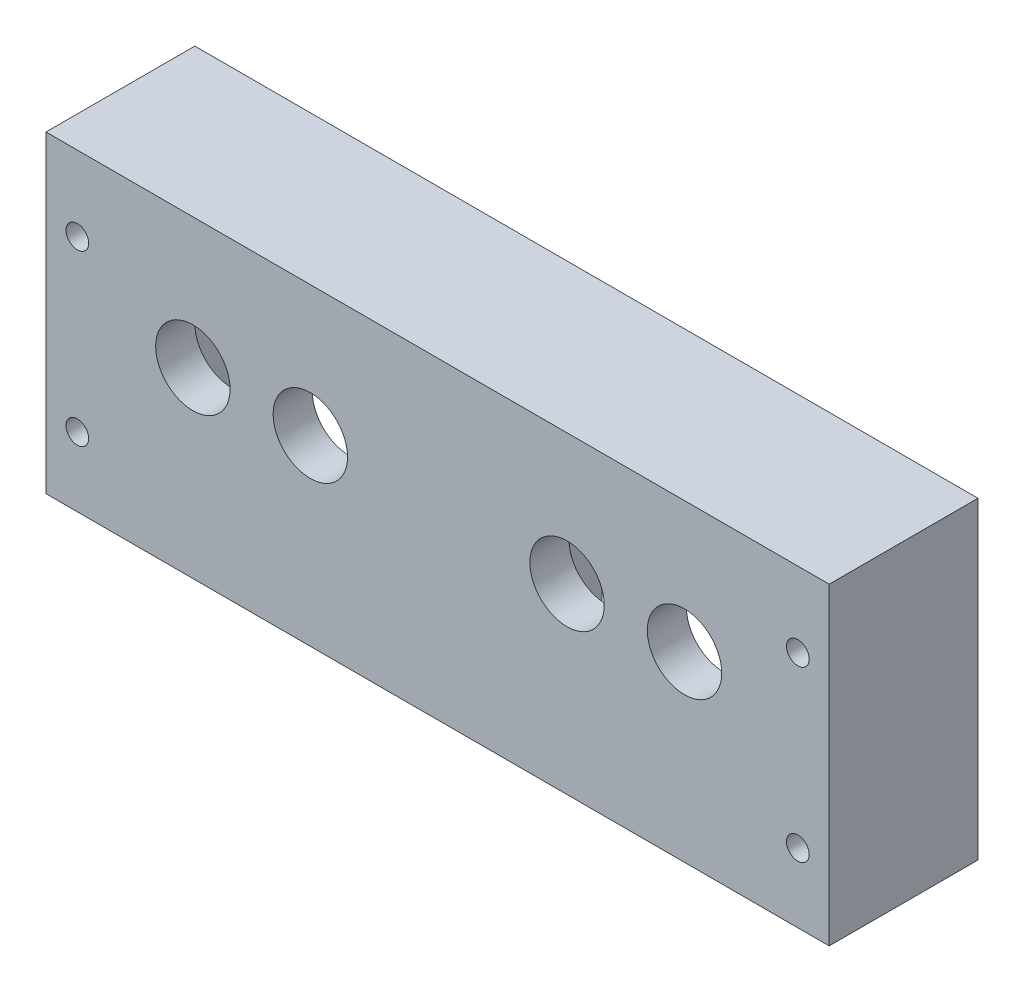
from build123d import *

# Parameters (mm, degrees)
SKETCH1_W           = 100
SKETCH1_H           = 40
BOSS_EXTRUDE1_DEPTH = 38
CUT_EXTRUDE2_START  = -12
SKETCH2_W           = 39.5
SKETCH2_H           = 34
CUT_EXTRUDE2_DEPTH  = 21
CUT_EXTRUDE3_DEPTH  = 9
CUT_EXTRUDE4_REACH  = 81.36
SKETCH4_R           = 1.45
SKETCH5_W           = 100
SKETCH5_H           = 19
CUT_EXTRUDE5_DEPTH  = 87.215210375
FILLET1_R           = 0.5
CUT_EXTRUDE9_START  = 13.5
CUT_EXTRUDE9_DEPTH  = 0.5
CUT_EXTRUDE9_TAPER  = 2
CUT_EXTRUDE10_START = 13.5
CUT_EXTRUDE10_DEPTH = 0.5
CUT_EXTRUDE10_TAPER = 2
CUT_EXTRUDE11_REACH = 73.063
SKETCH10_R          = 4.75


with BuildPart() as part:
    # Sketch1 → Boss-Extrude1 (new body)
    with BuildSketch(Plane.XY):
        with Locations((16.25, 1.5625)):
            Rectangle(SKETCH1_W, SKETCH1_H)
    extrude(amount=BOSS_EXTRUDE1_DEPTH)

    # Sketch2 → Cut-Extrude2 (cut)
    with BuildSketch(Plane(origin=(0, 0, 0), x_dir=(-1, 0, 0), z_dir=(0, 0, -1)).offset(CUT_EXTRUDE2_START)):
        with Locations((-38.5, 1.5625)):
            Rectangle(SKETCH2_W, SKETCH2_H)
        with Locations((6, 1.5625)):
            Rectangle(SKETCH2_W, SKETCH2_H)
    extrude(amount=-CUT_EXTRUDE2_DEPTH, mode=Mode.SUBTRACT)

    # Sketch3 → Cut-Extrude3 (cut)
    with BuildSketch(Plane(origin=(-3.362318072, 0, 0), x_dir=(-1, 0, 0), z_dir=(0, 0, -1))):
        with BuildLine():
            ThreePointArc((-61.593370612, 1.614325749), (-20.676836723, -17.421621422), (21.715969185, -1.949710178))
            ThreePointArc((21.715969185, -1.949710178), (22.204299442, 9.465009595), (10.78957967, 9.953339852))
            ThreePointArc((10.78957967, 9.953339852), (-19.986233449, -1.278769909), (-49.690320582, 12.540715264))
            ThreePointArc((-49.690320582, 12.540715264), (-61.105040355, 13.029045522), (-61.593370612, 1.614325749))
        make_face()
    extrude(amount=-CUT_EXTRUDE3_DEPTH, mode=Mode.SUBTRACT)

    # Sketch4 → Cut-Extrude4 (cut, up to next)
    with BuildSketch(Plane(origin=(0, 0, 0), x_dir=(-1, 0, 0), z_dir=(0, 0, -1)), mode=Mode.PRIVATE) as cut_extrude4_sk1:
        with Locations((-62.25, 11.98479819)):
            Circle(SKETCH4_R)
    cut_extrude4_tool1 = extrude(cut_extrude4_sk1.sketch, amount=-CUT_EXTRUDE4_REACH, mode=Mode.PRIVATE) & part.part
    # Sketch4 → Cut-Extrude4 (cut, up to next)
    with BuildSketch(Plane(origin=(0, 0, 0), x_dir=(-1, 0, 0), z_dir=(0, 0, -1)), mode=Mode.PRIVATE) as cut_extrude4_sk2:
        with Locations((-62.25, -9.616561755)):
            Circle(SKETCH4_R)
    cut_extrude4_tool2 = extrude(cut_extrude4_sk2.sketch, amount=-CUT_EXTRUDE4_REACH, mode=Mode.PRIVATE) & part.part
    # Sketch4 → Cut-Extrude4 (cut, up to next)
    with BuildSketch(Plane(origin=(0, 0, 0), x_dir=(-1, 0, 0), z_dir=(0, 0, -1)), mode=Mode.PRIVATE) as cut_extrude4_sk3:
        with Locations((29.75, 11.98479819)):
            Circle(SKETCH4_R)
    cut_extrude4_tool3 = extrude(cut_extrude4_sk3.sketch, amount=-CUT_EXTRUDE4_REACH, mode=Mode.PRIVATE) & part.part
    # Sketch4 → Cut-Extrude4 (cut, up to next)
    with BuildSketch(Plane(origin=(0, 0, 0), x_dir=(-1, 0, 0), z_dir=(0, 0, -1)), mode=Mode.PRIVATE) as cut_extrude4_sk4:
        with Locations((29.75, -9.616561755)):
            Circle(SKETCH4_R)
    cut_extrude4_tool4 = extrude(cut_extrude4_sk4.sketch, amount=-CUT_EXTRUDE4_REACH, mode=Mode.PRIVATE) & part.part
    add(cut_extrude4_tool1.solids().sort_by_distance((62.25, 11.984798, 0))[0], mode=Mode.SUBTRACT)
    add(cut_extrude4_tool2.solids().sort_by_distance((62.25, -9.616562, 0))[0], mode=Mode.SUBTRACT)
    add(cut_extrude4_tool3.solids().sort_by_distance((-29.75, 11.984798, 0))[0], mode=Mode.SUBTRACT)
    add(cut_extrude4_tool4.solids().sort_by_distance((-29.75, -9.616562, 0))[0], mode=Mode.SUBTRACT)

    # Sketch5 → Cut-Extrude5 (cut, through all)
    with BuildSketch(Plane(origin=(0, 21.5625, 0), x_dir=(1, 0, 0), z_dir=(0, 1, 0))):
        with Locations((16.25, -9.5)):
            Rectangle(SKETCH5_W, SKETCH5_H)
    extrude(amount=-CUT_EXTRUDE5_DEPTH, mode=Mode.SUBTRACT)

    # Fillet1
    fillet1_edges = [part.edges().sort_by_distance(p)[0] for p in [
        (18.75, 18.5625, 26),
        (58.25, 18.5625, 26),
        (58.25, -15.4375, 26),
        (18.75, -15.4375, 26),
        (13.75, -15.4375, 26),
        (13.75, 18.5625, 26),
        (-25.75, 18.5625, 26),
        (-25.75, -15.4375, 26),
    ]]
    fillet(fillet1_edges, radius=FILLET1_R)

    # Sketch8 → Cut-Extrude9 (cut)
    with BuildSketch(Plane(origin=(0, 0, 33), x_dir=(-1, 0, 0), z_dir=(0, 0, -1)).offset(CUT_EXTRUDE9_START)):
        with BuildLine():
            Line((-18.25, -14.9375), (-18.25, 18.0625))
            ThreePointArc((-18.25, 18.0625), (-18.542893219, 18.769606781), (-19.25, 19.0625))
            Line((-19.25, 19.0625), (-57.75, 19.0625))
            ThreePointArc((-57.75, 19.0625), (-58.457106781, 18.769606781), (-58.75, 18.0625))
            Line((-58.75, 18.0625), (-58.75, -14.9375))
            ThreePointArc((-58.75, -14.9375), (-58.457106781, -15.644606781), (-57.75, -15.9375))
            Line((-57.75, -15.9375), (-19.25, -15.9375))
            ThreePointArc((-19.25, -15.9375), (-18.542893219, -15.644606781), (-18.25, -14.9375))
        make_face()
    extrude(amount=CUT_EXTRUDE9_DEPTH, taper=CUT_EXTRUDE9_TAPER, mode=Mode.SUBTRACT)

    # Sketch9 → Cut-Extrude10 (cut)
    with BuildSketch(Plane(origin=(0, 0, 33), x_dir=(-1, 0, 0), z_dir=(0, 0, -1)).offset(CUT_EXTRUDE10_START)):
        with BuildLine():
            Line((-14.25, 18.0625), (-14.25, -14.9375))
            ThreePointArc((-14.25, -14.9375), (-13.957106781, -15.644606781), (-13.25, -15.9375))
            Line((-13.25, -15.9375), (25.25, -15.9375))
            ThreePointArc((25.25, -15.9375), (25.957106781, -15.644606781), (26.25, -14.9375))
            Line((26.25, -14.9375), (26.25, 18.0625))
            ThreePointArc((26.25, 18.0625), (25.957106781, 18.769606781), (25.25, 19.0625))
            Line((25.25, 19.0625), (-13.25, 19.0625))
            ThreePointArc((-13.25, 19.0625), (-13.957106781, 18.769606781), (-14.25, 18.0625))
        make_face()
    extrude(amount=CUT_EXTRUDE10_DEPTH, taper=CUT_EXTRUDE10_TAPER, mode=Mode.SUBTRACT)

    # Sketch10 → Cut-Extrude11 (cut, up to next)
    with BuildSketch(Plane(origin=(0, 0, 33), x_dir=(-1, 0, 0), z_dir=(0, 0, -1)), mode=Mode.PRIVATE) as cut_extrude11_sk1:
        with Locations((-47.777200651, 4.85170637)):
            Circle(SKETCH10_R)
    cut_extrude11_tool1 = extrude(cut_extrude11_sk1.sketch, amount=-CUT_EXTRUDE11_REACH, mode=Mode.PRIVATE) & part.part
    # Sketch10 → Cut-Extrude11 (cut, up to next)
    with BuildSketch(Plane(origin=(0, 0, 33), x_dir=(-1, 0, 0), z_dir=(0, 0, -1)), mode=Mode.PRIVATE) as cut_extrude11_sk2:
        with Locations((-32.777211474, 4.869725449)):
            Circle(SKETCH10_R)
    cut_extrude11_tool2 = extrude(cut_extrude11_sk2.sketch, amount=-CUT_EXTRUDE11_REACH, mode=Mode.PRIVATE) & part.part
    # Sketch10 → Cut-Extrude11 (cut, up to next)
    with BuildSketch(Plane(origin=(0, 0, 33), x_dir=(-1, 0, 0), z_dir=(0, 0, -1)), mode=Mode.PRIVATE) as cut_extrude11_sk3:
        with Locations((0, 4.87445836)):
            Circle(SKETCH10_R)
    cut_extrude11_tool3 = extrude(cut_extrude11_sk3.sketch, amount=-CUT_EXTRUDE11_REACH, mode=Mode.PRIVATE) & part.part
    # Sketch10 → Cut-Extrude11 (cut, up to next)
    with BuildSketch(Plane(origin=(0, 0, 33), x_dir=(-1, 0, 0), z_dir=(0, 0, -1)), mode=Mode.PRIVATE) as cut_extrude11_sk4:
        with Locations((15, 4.87445836)):
            Circle(SKETCH10_R)
    cut_extrude11_tool4 = extrude(cut_extrude11_sk4.sketch, amount=-CUT_EXTRUDE11_REACH, mode=Mode.PRIVATE) & part.part
    add(cut_extrude11_tool1.solids().sort_by_distance((47.777201, 4.851706, 33))[0], mode=Mode.SUBTRACT)
    add(cut_extrude11_tool2.solids().sort_by_distance((32.777211, 4.869725, 33))[0], mode=Mode.SUBTRACT)
    add(cut_extrude11_tool3.solids().sort_by_distance((0, 4.874458, 33))[0], mode=Mode.SUBTRACT)
    add(cut_extrude11_tool4.solids().sort_by_distance((-15, 4.874458, 33))[0], mode=Mode.SUBTRACT)


solid = part.part
